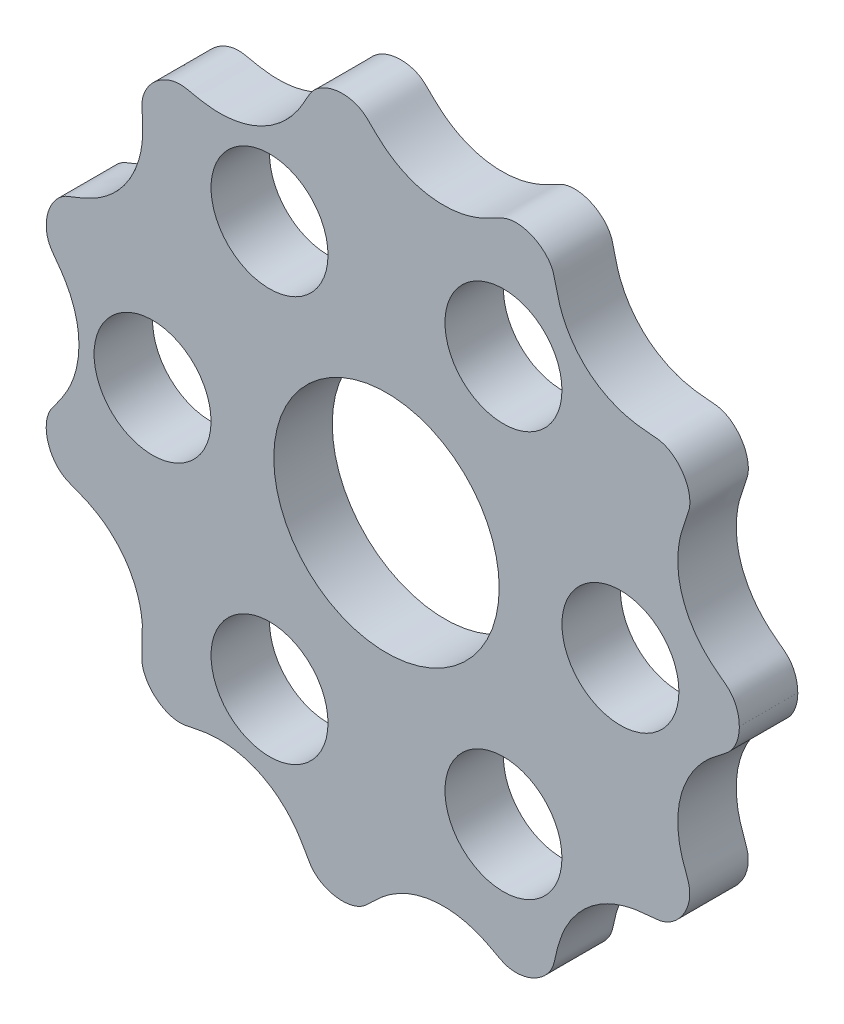
from build123d import *

# Parameters (mm, degrees)
BOSS_EXTRU_2_DEPTH      = 5.5
ESQUISSE3_R             = 10.6
ESQUISSE3_R_2           = 5.5
ENL_V_MAT_EXTRU_1_DEPTH = 5.5


# Read off the part's stored shape, not the designer's step: Boss.-Extru.2
with BuildPart() as part:
    # Boss.-Extru.2 outline → Boss.-Extru.2 (new body)
    with BuildSketch(Plane.XY):
        with BuildLine():
            add(Edge.make_bspline(
                [(33.18, 0), (33.18, 0.008117796), (33.1800055, 0.013501535), (33.178502417, 0.111078294), (33.175761843, 0.192871244), (33.171838088, 0.263796565), (33.157645514, 0.447834066), (33.122588904, 0.710136993), (33.045434396, 1.053132061), (32.941011664, 1.376788342), (32.812382345, 1.678038703), (32.66408246, 1.95141717), (32.527299477, 2.15470559), (32.411282327, 2.302892233), (32.320055594, 2.408416897), (32.222219485, 2.510982021), (32.114521333, 2.613738313), (31.981628715, 2.729358479), (31.830359539, 2.850802247), (31.643950743, 2.992970396), (31.445630786, 3.142130434), (31.149038901, 3.365460923), (30.68078417, 3.73904426), (29.991205307, 4.342618244), (29.133851667, 5.335451287), (28.382356415, 6.480690607), (27.736377573, 7.993912394), (27.400416941, 9.653402871), (27.379163617, 11.058609775), (27.551731385, 12.457639618), (27.812591511, 13.374985405), (28.012053512, 13.974728238), (28.14465797, 14.333054908), (28.233636106, 14.573348494), (28.294895253, 14.74168384), (28.355737347, 14.916510668), (28.406420458, 15.077217095), (28.447097032, 15.228249018), (28.489074768, 15.419316009), (28.521934488, 15.646627441), (28.535623036, 15.935060037), (28.520704008, 16.241875635), (28.474788288, 16.561656683), (28.370452774, 16.998429849), (28.157789297, 17.548715969), (27.781300267, 18.166634652), (27.386367329, 18.612301064), (27.040078739, 18.911181599), (26.770886661, 19.103735652), (26.498251588, 19.262823541), (26.226392342, 19.388467182), (26.006364955, 19.465555725), (25.825108682, 19.514610378), (25.684232735, 19.545521635), (25.530128357, 19.571805566), (25.366110578, 19.5926301), (25.191618628, 19.609463102), (25.018296187, 19.623573305), (24.780362691, 19.641266579), (24.421687048, 19.667485414), (23.84725579, 19.725357427), (22.996298738, 19.845210931), (21.792353127, 20.181433234), (20.594119513, 20.679640822), (19.219541633, 21.552488403), (18.004020644, 22.724549285), (17.149445206, 23.937091408), (16.490037577, 25.250319739), (16.181852366, 26.232420146), (16.021753841, 26.855690407), (15.933239426, 27.253081223), (15.878180376, 27.504402827), (15.823333674, 27.747977515), (15.77508416, 27.940924071), (15.724852459, 28.112886265), (15.676239448, 28.255031763), (15.623906554, 28.387304375), (15.547272385, 28.556388658), (15.434017508, 28.764763392), (15.264901508, 29.015184079), (15.062377142, 29.261277068), (14.827453467, 29.498243315), (14.47534562, 29.794171074), (13.971217335, 30.114094008), (13.30167118, 30.387499323), (12.727009953, 30.50940061), (12.282261059, 30.542567959), (11.962191163, 30.536897808), (11.660251585, 30.502855067), (11.427794934, 30.453733543), (11.249359507, 30.40235544), (11.113837232, 30.355989343), (10.978664544, 30.302561826), (10.818972283, 30.230669535), (10.651741624, 30.147242936), (10.453489739, 30.041752071), (10.247385991, 29.930148708), (9.946389456, 29.765877699), (9.445434097, 29.510025749), (8.722772908, 29.170508759), (7.5829751, 28.801540362), (6.384550555, 28.558666245), (4.786851327, 28.50079118), (3.114484071, 28.777145687), (1.673232614, 29.316545553), (0.337458425, 30.071727584), (-0.521214139, 30.774158436), (-1.008810258, 31.225071481), (-1.310619776, 31.522750275), (-1.498405241, 31.710116915), (-1.635933465, 31.845887356), (-1.772164821, 31.976927167), (-1.899937819, 32.092918842), (-2.023807755, 32.19627642), (-2.139276635, 32.283774204), (-2.294848721, 32.390325362), (-2.495337043, 32.50715873), (-2.766123319, 32.631926563), (-3.062842192, 32.73563449), (-3.382978434, 32.815149366), (-3.721259726, 32.866977424), (-4.188757452, 32.896111702), (-4.788744236, 32.853654101), (-5.369931133, 32.706186272), (-5.80079851, 32.533280939), (-6.101805529, 32.379660057), (-6.376029359, 32.206256913), (-6.619674584, 32.018093316), (-6.831799571, 31.819095875), (-6.983907521, 31.645986339), (-7.099485511, 31.493458036), (-7.188034261, 31.364347493), (-7.272361699, 31.22919306), (-7.358308321, 31.081640341), (-7.439544815, 30.937007642), (-7.547634017, 30.740722824), (-7.709175513, 30.445323989), (-7.975444584, 29.983937026), (-8.382635009, 29.330675378), (-9.076380635, 28.458668276), (-9.901383392, 27.620990304), (-11.1496929, 26.699838113), (-12.680017107, 25.978640842), (-14.221682975, 25.597471284), (-15.833611863, 25.472744938), (-17.005581834, 25.596968865), (-17.686144247, 25.71515257), (-18.118640707, 25.8053706), (-18.385134757, 25.86312344), (-18.643590118, 25.917786395), (-18.842306188, 25.955282477), (-19.027043887, 25.982772791), (-19.174207486, 25.997891371), (-19.318070317, 26.00594458), (-19.457942408, 26.00687583), (-19.644615266, 25.999081736), (-19.887031172, 25.971373411), (-20.190228275, 25.90697776), (-20.501415158, 25.809738124), (-20.918887131, 25.635943426), (-21.430119128, 25.337419689), (-21.980575899, 24.867417114), (-22.356669105, 24.407988005), (-22.595133541, 24.020925598), (-22.741079582, 23.726923101), (-22.853447122, 23.435134583), (-22.919809496, 23.197456812), (-22.957206109, 23.01342874), (-22.978276027, 22.875819104), (-22.992946239, 22.7339528), (-23.001109063, 22.58664933), (-23.002657562, 22.420080161), (-22.996815676, 22.234006444), (-22.984379575, 22.020464788), (-22.969537703, 21.800303773), (-22.946730973, 21.481982497), (-22.920814674, 20.95937477), (-22.906873503, 20.244550765), (-22.999706248, 19.184536456), (-23.208293033, 18.088290974), (-23.697006353, 16.682011309), (-24.552653099, 15.210556736), (-25.625442832, 14.006779307), (-26.631305772, 13.2044749), (-27.412848572, 12.719774298), (-28.182101616, 12.322419671), (-28.740485972, 12.08966579), (-29.167279464, 11.923878579), (-29.431173174, 11.825695086), (-29.621624625, 11.75343789), (-29.805602202, 11.681294366), (-29.966637963, 11.612814991), (-30.116652637, 11.541598705), (-30.286273807, 11.451030812), (-30.483270542, 11.327027763), (-30.709614467, 11.151660947), (-30.93247787, 10.94212092), (-31.145107272, 10.700546723), (-31.342903721, 10.429082493), (-31.580343391, 10.032197158), (-31.816621318, 9.482356239), (-31.980039021, 8.778473969), (-32.008829248, 8.194401898), (-31.970941366, 7.753294569), (-31.914787732, 7.441325966), (-31.833617029, 7.151654132), (-31.749078276, 6.933152748), (-31.669071591, 6.763934336), (-31.601384001, 6.637137178), (-31.523619308, 6.506630548), (-31.418468243, 6.346491657), (-31.29227331, 6.169723655), (-31.121148906, 5.938956413), (-30.935424725, 5.690778033), (-30.645782718, 5.288481798), (-30.256208356, 4.711440282), (-29.785960511, 3.840226552), (-29.371304813, 2.869578791), (-28.995595716, 1.471022298), (-28.866064725, -0.192514667), (-29.076460528, -1.850311249), (-29.47009577, -3.107573276), (-29.880246052, -4.010627044), (-30.333626521, -4.812239109), (-30.685614286, -5.324991008), (-30.957147576, -5.701352808), (-31.14930884, -5.957630569), (-31.271031661, -6.121422031), (-31.352742256, -6.234118956), (-31.444085615, -6.364751776), (-31.531499248, -6.498432422), (-31.610945627, -6.632562789), (-31.676100103, -6.755334237), (-31.75501652, -6.923201366), (-31.840469176, -7.145701077), (-31.920495582, -7.43422637), (-31.976065518, -7.746826947), (-32.01301465, -8.189232424), (-31.982931899, -8.77300704), (-31.817876672, -9.477077948), (-31.580531908, -10.026000661), (-31.342368227, -10.42210588), (-31.144192017, -10.692793671), (-30.931327331, -10.933512175), (-30.708310861, -11.142188262), (-30.48204067, -11.316633458), (-30.284559038, -11.440264183), (-30.114338983, -11.530644396), (-29.962056647, -11.602523485), (-29.798064979, -11.6719061), (-29.607774406, -11.74623477), (-29.409781284, -11.82128998), (-29.13228092, -11.924620514), (-28.680552136, -12.102167197), (-28.084422708, -12.354351957), (-27.248156702, -12.803908133), (-26.415488887, -13.348890128), (-25.365630301, -14.252382253), (-24.325329119, -15.538048703), (-23.551974173, -17.033956751), (-23.14839703, -18.370123268), (-22.98317154, -19.394488205), (-22.917210882, -20.357843877), (-22.934025287, -21.026018519), (-22.960707906, -21.516578073), (-22.982581262, -21.820235069), (-22.996750412, -22.030686296), (-23.00856003, -22.237828576), (-23.013946318, -22.419939063), (-23.01206065, -22.584357915), (-23.003578963, -22.731222043), (-22.988593074, -22.87272917), (-22.967183548, -23.010315128), (-22.929272983, -23.194552439), (-22.862218743, -23.432492296), (-22.74898282, -23.724484023), (-22.60216956, -24.018537053), (-22.362599471, -24.405444256), (-21.985299767, -24.864271907), (-21.43382913, -25.333058584), (-20.922225548, -25.630279852), (-20.504798197, -25.802951893), (-20.193818589, -25.899340999), (-19.890964898, -25.962913897), (-19.648943373, -25.989984415), (-19.462467905, -25.997313286), (-19.322501025, -25.996035689), (-19.178393156, -25.9876253), (-19.030207899, -25.972040855), (-18.84280713, -25.943799163), (-18.638992619, -25.904912346), (-18.370131463, -25.848045839), (-18.090372413, -25.787139606), (-17.632467013, -25.694622536), (-17.022631272, -25.5878105), (-16.136868788, -25.50833033), (-15.181915416, -25.501793261), (-13.882452676, -25.651313416), (-12.311286842, -26.116605191), (-10.820307366, -26.912873736), (-9.681536777, -27.832914689), (-8.945181616, -28.625201894), (-8.314862361, -29.450917842), (-7.954263103, -30.041704345), (-7.698158432, -30.488665212), (-7.549566838, -30.761529468), (-7.443033177, -30.954783009), (-7.365236181, -31.092940796), (-7.282185762, -31.235036441), (-7.196748713, -31.371326524), (-7.110879411, -31.495853891), (-7.023225691, -31.611065139), (-6.932995732, -31.718341911), (-6.806330209, -31.854914445), (-6.628827758, -32.02056781), (-6.384129318, -32.208628571), (-6.109181008, -32.381600868), (-5.807605126, -32.534654624), (-5.375899572, -32.706783725), (-4.794350189, -32.852986934), (-4.194264518, -32.894133746), (-3.727220845, -32.863988137), (-3.38941661, -32.811458631), (-3.069644352, -32.731263732), (-2.773848339, -32.627067738), (-2.504180799, -32.502085369), (-2.303114181, -32.384218084), (-2.148910836, -32.278047562), (-2.033057219, -32.189816757), (-1.906832663, -32.084062474), (-1.778349477, -31.966937671), (-1.636769313, -31.830349418), (-1.495057802, -31.690462571), (-1.297189868, -31.492606509), (-0.978461953, -31.181886402), (-0.53883482, -30.774215217), (0.115322985, -30.256223374), (0.859561299, -29.75372054), (1.971120162, -29.174680649), (3.498470416, -28.680838341), (5.177078031, -28.489118464), (6.702934349, -28.612190852), (7.803732343, -28.872879212), (8.843145362, -29.233883759), (9.503589714, -29.550915886), (9.977036373, -29.795381871), (10.260799001, -29.950696233), (10.459212267, -30.058112786), (10.650313507, -30.159532781), (10.814634864, -30.24114736), (10.972036516, -30.3115975), (11.10693507, -30.364557693), (11.242272521, -30.410487633), (11.420850669, -30.461436029), (11.653881399, -30.510087222), (11.956400696, -30.543461932), (12.276967469, -30.548396549), (12.72216294, -30.514178019), (13.296917823, -30.390915408), (13.965954612, -30.116015655), (14.469154205, -29.795118552), (14.820403972, -29.498574484), (15.054281053, -29.261573707), (15.255998294, -29.015332531), (15.424617236, -28.764289323), (15.536485252, -28.55727098), (15.612850134, -28.387728852), (15.665698795, -28.25314772), (15.713657183, -28.111865174), (15.764014992, -27.938251086), (15.814079024, -27.736334113), (15.869746494, -27.48860844), (15.92870208, -27.218941959), (16.022337695, -26.807755892), (16.167846687, -26.2399473), (16.409795923, -25.509282679), (16.740962024, -24.707773084), (17.304326909, -23.672512862), (18.258869485, -22.432980936), (19.538479179, -21.317222583), (20.903446811, -20.53655022), (22.025491136, -20.115090618), (23.14282607, -19.829735371), (23.920344045, -19.728053666), (24.4659247, -19.675357771), (24.803522535, -19.651268305), (25.032648193, -19.634191861), (25.199450539, -19.62044942), (25.369251219, -19.603806967), (25.530790179, -19.582972066), (25.683129311, -19.556627583), (25.823748851, -19.525427537), (26.004638989, -19.475990727), (26.224880806, -19.398232451), (26.496900439, -19.271715997), (26.769604685, -19.111731428), (27.038662673, -18.918344283), (27.384640498, -18.61836778), (27.778681146, -18.171778069), (28.153969344, -17.552690484), (28.365045372, -17.002910769), (28.468418409, -16.565934679), (28.513568144, -16.245858062), (28.527689339, -15.94170413), (28.513168805, -15.651240791), (28.479773756, -15.42423398), (28.438398811, -15.2382755), (28.39512489, -15.078506562), (28.341234341, -14.909103796), (28.283669936, -14.744456724), (28.22147453, -14.574312642), (28.123248261, -14.310754471), (27.97774455, -13.909067248), (27.782867921, -13.318899715), (27.49961499, -12.265062056), (27.359494101, -10.769159916), (27.443182007, -9.274796705), (27.866685606, -7.615062945), (28.560857407, -6.180054493), (29.3017869, -5.136298233), (30.110453818, -4.244797749), (30.748409265, -3.697352031), (31.189981087, -3.348526005), (31.473589516, -3.135679958), (31.660919663, -2.994806585), (31.841980726, -2.856436953), (31.989529485, -2.737564267), (32.119905284, -2.623619644), (32.227348912, -2.520659213), (32.324486366, -2.418308843), (32.415420251, -2.312607514), (32.531435743, -2.163676162), (32.667781515, -1.959935563), (32.815799625, -1.685679889), (32.943776826, -1.383510251), (33.04717277, -1.062337152), (33.11188346, -0.768334451), (33.146166138, -0.549575112), (33.167327909, -0.350262376), (33.175212983, -0.22825027), (33.178737352, -0.116984023), (33.18001566, -0.019846885), (33.180004764, -0.013956028), (33.1799868, -0.005675736)],
                knots=[0.071755768, 0.071755768, 0.071755768, 0.071755768, 0.072173975, 0.072592182, 0.073428596, 0.07426501, 0.075101424, 0.07844708, 0.081792736, 0.085138392, 0.088484048, 0.091829704, 0.09517536, 0.096848188, 0.098521016, 0.100193844, 0.101866672, 0.1035395, 0.105212328, 0.106048742, 0.106885156, 0.10772157, 0.108557984, 0.109394398, 0.109812605, 0.110230812, 0.110649019, 0.111067226, 0.111485433, 0.11190364, 0.112740054, 0.113576468, 0.114412882, 0.115249296, 0.11608571, 0.116922124, 0.118594952, 0.12026778, 0.121940608, 0.125286264, 0.12863192, 0.131977575, 0.135323231, 0.138668887, 0.145360199, 0.152051511, 0.158742823, 0.162088479, 0.165434135, 0.168779791, 0.172125447, 0.175471103, 0.177143931, 0.178816759, 0.180489587, 0.182162415, 0.182998829, 0.183835243, 0.184671657, 0.185508071, 0.186344485, 0.187180899, 0.187599106, 0.188017313, 0.18843552, 0.188853727, 0.189271934, 0.189690141, 0.190526555, 0.191362969, 0.192199383, 0.193035797, 0.193872211, 0.195545039, 0.197217867, 0.198890695, 0.200563523, 0.202236351, 0.205582007, 0.208927663, 0.212273319, 0.215618975, 0.218964631, 0.225655943, 0.232347254, 0.239038566, 0.242384222, 0.245729878, 0.249075534, 0.25242119, 0.254094018, 0.255766846, 0.257439674, 0.259112502, 0.26078533, 0.261621744, 0.262458158, 0.263294572, 0.264130986, 0.2649674, 0.265385607, 0.265803814, 0.266222021, 0.266640228, 0.267058435, 0.267476642, 0.268313056, 0.26914947, 0.269985884, 0.270822298, 0.271658712, 0.272495126, 0.274167954, 0.275840782, 0.27751361, 0.279186438, 0.282532094, 0.28587775, 0.289223406, 0.292569062, 0.295914718, 0.299260374, 0.305951686, 0.312642998, 0.315988654, 0.31933431, 0.322679966, 0.326025621, 0.329371277, 0.332716933, 0.334389761, 0.336062589, 0.337735417, 0.338571831, 0.339408245, 0.340244659, 0.341081073, 0.341917487, 0.342753901, 0.343172108, 0.343590315, 0.344008522, 0.344426729, 0.344844936, 0.345263143, 0.346099557, 0.346935971, 0.347772385, 0.348608799, 0.349445213, 0.351118041, 0.352790869, 0.354463697, 0.356136525, 0.357809353, 0.359482181, 0.362827837, 0.366173493, 0.369519149, 0.372864805, 0.379556117, 0.386247429, 0.392938741, 0.396284397, 0.399630053, 0.402975709, 0.406321365, 0.407994193, 0.409667021, 0.411339849, 0.413012677, 0.414685505, 0.416358333, 0.417194747, 0.418031161, 0.418867575, 0.419703989, 0.420540403, 0.42095861, 0.421376817, 0.421795024, 0.422213231, 0.422631437, 0.423049644, 0.423467851, 0.423886058, 0.424722472, 0.425558886, 0.4263953, 0.427231714, 0.428068128, 0.429740956, 0.431413784, 0.433086612, 0.436432268, 0.439777924, 0.44312358, 0.446469236, 0.449814892, 0.453160548, 0.45985186, 0.466543172, 0.473234484, 0.47658014, 0.479925796, 0.483271452, 0.486617108, 0.488289936, 0.489962764, 0.491635592, 0.49330842, 0.494981248, 0.495817662, 0.496654076, 0.49749049, 0.498326904, 0.498745111, 0.499163318, 0.499581525, 0.499999732, 0.500417939, 0.500836146, 0.501254353, 0.50167256, 0.502508974, 0.503345388, 0.504181802, 0.505018216, 0.50585463, 0.506691044, 0.508363872, 0.5100367, 0.511709528, 0.513382356, 0.516728012, 0.520073667, 0.523419323, 0.526764979, 0.533456291, 0.540147603, 0.546838915, 0.550184571, 0.553530227, 0.556875883, 0.560221539, 0.563567195, 0.566912851, 0.568585679, 0.570258507, 0.571931335, 0.572767749, 0.573604163, 0.574440577, 0.575276991, 0.576113405, 0.576531612, 0.576949819, 0.577368026, 0.577786233, 0.57820444, 0.578622647, 0.579040854, 0.579459061, 0.580295475, 0.581131889, 0.581968303, 0.582804717, 0.583641131, 0.585313959, 0.586986787, 0.588659615, 0.590332443, 0.592005271, 0.593678099, 0.597023755, 0.600369411, 0.603715067, 0.607060723, 0.613752035, 0.620443346, 0.627134658, 0.630480314, 0.63382597, 0.637171626, 0.640517282, 0.64219011, 0.643862938, 0.645535766, 0.647208594, 0.648881422, 0.65055425, 0.651390664, 0.652227078, 0.653063492, 0.653899906, 0.654318113, 0.65473632, 0.655154527, 0.655572734, 0.655990941, 0.656409148, 0.656827355, 0.657245562, 0.658081976, 0.65891839, 0.659754804, 0.660591218, 0.661427632, 0.662264046, 0.663936874, 0.665609702, 0.66728253, 0.668955358, 0.670628186, 0.673973842, 0.677319498, 0.680665154, 0.68401081, 0.687356466, 0.694047778, 0.70073909, 0.704084746, 0.707430402, 0.710776058, 0.714121713, 0.717467369, 0.720813025, 0.722485853, 0.724158681, 0.725831509, 0.727504337, 0.728340751, 0.729177165, 0.730013579, 0.730849993, 0.731686407, 0.732104614, 0.732522821, 0.732941028, 0.733359235, 0.733777442, 0.734195649, 0.734613856, 0.735032063, 0.735868477, 0.736704891, 0.737541305, 0.738377719, 0.739214133, 0.740886961, 0.742559789, 0.744232617, 0.745905445, 0.747578273, 0.750923929, 0.754269585, 0.757615241, 0.760960897, 0.767652209, 0.774343521, 0.781034833, 0.784380489, 0.787726145, 0.791071801, 0.794417457, 0.797763113, 0.799435941, 0.801108769, 0.802781597, 0.804454425, 0.806127253, 0.806963667, 0.807800081, 0.808636495, 0.809472909, 0.809891116, 0.810309323, 0.81072753, 0.811145737, 0.811563943, 0.81198215, 0.812400357, 0.812818564, 0.813654978, 0.814491392, 0.815327806, 0.81616422, 0.817000634, 0.817837048, 0.819509876, 0.821182704, 0.822855532, 0.82452836, 0.827874016, 0.831219672, 0.834565328, 0.837910984, 0.84125664, 0.847947952, 0.854639264, 0.861330576, 0.864676232, 0.868021888, 0.871367544, 0.8747132, 0.878058856, 0.879731684, 0.881404512, 0.88307734, 0.883913754, 0.884750168, 0.885586582, 0.886422996, 0.88725941, 0.888095824, 0.888514031, 0.888932238, 0.889350445, 0.889768652, 0.890186859, 0.890605066, 0.89144148, 0.892277894, 0.893114308, 0.893950722, 0.894787136, 0.896459964, 0.898132792, 0.89980562, 0.901478448, 0.903151276, 0.904824104, 0.90816976, 0.911515415, 0.914861071, 0.918206727, 0.921552383, 0.923225211, 0.924898039, 0.926570867, 0.927407281, 0.927825488, 0.928243695, 0.928243695, 0.928243695, 0.928243695], degree=3))
            Line((33.1799868, -0.005675736), (33.18, 0))
        make_face()
    extrude(amount=BOSS_EXTRU_2_DEPTH)

    # Esquisse3 → Enlèv. mat.-Extru.1 (cut)
    with BuildSketch(Plane.XY.offset(5.5)):
        Circle(ESQUISSE3_R)
        with Locations((22, 0)):
            Circle(ESQUISSE3_R_2)
        with Locations((11, -19.052558883)):
            Circle(ESQUISSE3_R_2)
        with Locations((-11, -19.052558883)):
            Circle(ESQUISSE3_R_2)
        with Locations((-22, 0)):
            Circle(ESQUISSE3_R_2)
        with Locations((-11, 19.052558883)):
            Circle(ESQUISSE3_R_2)
        with Locations((11, 19.052558883)):
            Circle(ESQUISSE3_R_2)
    extrude(amount=-ENL_V_MAT_EXTRU_1_DEPTH, mode=Mode.SUBTRACT)


solid = part.part
